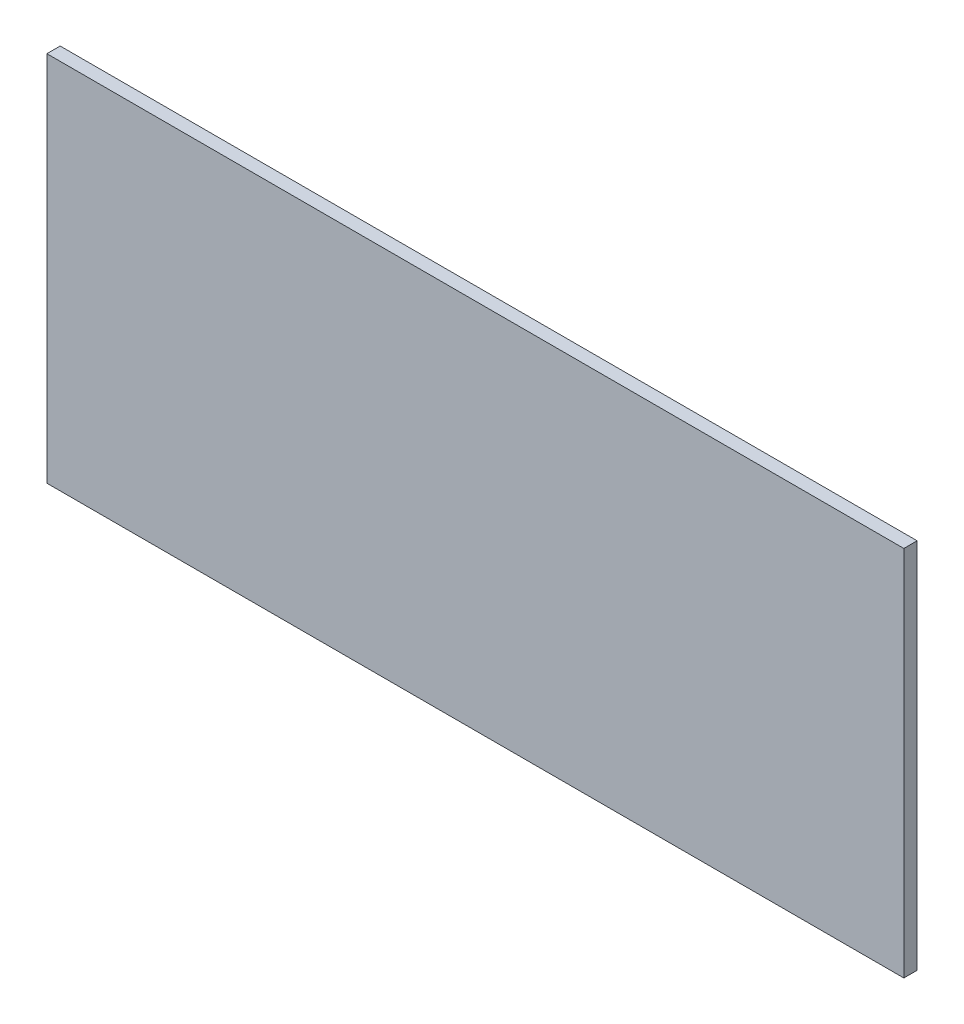
from build123d import *

# Parameters (mm, degrees)
SKETCH1_W           = 409.575
SKETCH1_H           = 177.8
BOSS_EXTRUDE1_DEPTH = 6.35


with BuildPart() as part:
    # Sketch1 → Boss-Extrude1 (new body)
    with BuildSketch(Plane.XY):
        with Locations((204.7875, 88.9)):
            Rectangle(SKETCH1_W, SKETCH1_H)
    extrude(amount=BOSS_EXTRUDE1_DEPTH)


solid = part.part
